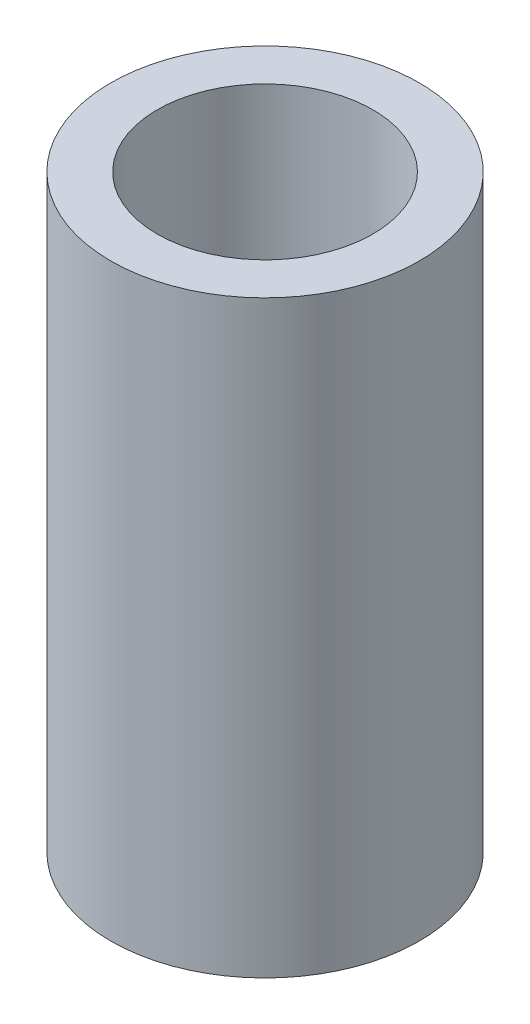
from build123d import *

# Parameters (mm, degrees)
SKETCH1_R           = 22.5
BOSS_EXTRUDE1_DEPTH = 85.901337951
SKETCH2_R           = 15.717273905
CUT_EXTRUDE1_DEPTH  = 92.605348434


with BuildPart() as part:
    # Sketch1 → Boss-Extrude1 (new body)
    with BuildSketch(Plane(origin=(0, 0, 0), x_dir=(1, 0, 0), z_dir=(0, 1, 0))):
        Circle(SKETCH1_R)
    extrude(amount=BOSS_EXTRUDE1_DEPTH)

    # Sketch2 → Cut-Extrude1 (cut, through all)
    with BuildSketch(Plane(origin=(0, 0, 0), x_dir=(1, 0, 0), z_dir=(0, 1, 0))):
        Circle(SKETCH2_R)
    extrude(amount=CUT_EXTRUDE1_DEPTH, mode=Mode.SUBTRACT)


solid = part.part
